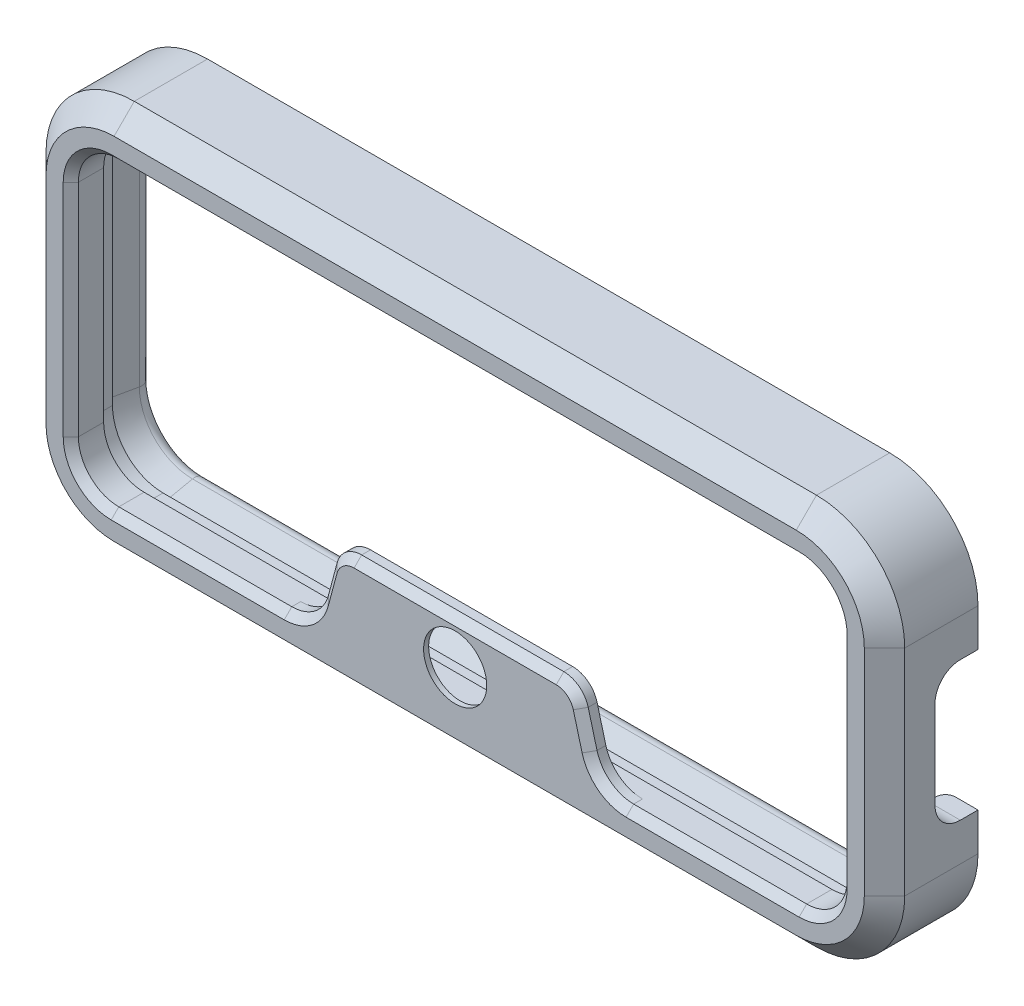
from build123d import *
from build123d.topology import SkipClean

# Parameters (mm, degrees)
SKIZZE1_W                         = 7.626009652
SKIZZE1_H                         = 10.039014478
AUFSATZ_LINEAR_AUSTRAGEN1_DEPTH   = 1.5
AUFSATZ_LINEAR_AUSTRAGEN1_2_DEPTH = 1.5
AUFSATZ_LINEAR_AUSTRAGEN1_3_DEPTH = 1.5
AUFSATZ_LINEAR_AUSTRAGEN1_4_DEPTH = 1.5
AUFSATZ_LINEAR_AUSTRAGEN1_5_DEPTH = 1.5
SKIZZE2_R                         = 2.5
AUFSATZ_LINEAR_AUSTRAGEN2_DEPTH   = 0.4
AUFSATZ_LINEAR_AUSTRAGEN3_DEPTH   = 2.2
AUFSATZ_LINEAR_AUSTRAGEN14_DEPTH  = 7
SKIZZE14_R                        = 2.5
SKIZZE14_W                        = 7.626009652
SKIZZE14_H                        = 10.039014478
AUFSATZ_LINEAR_AUSTRAGEN15_DEPTH  = 0.9
VERRUNDUNG1_R                     = 0.8
SCHNITT_LINEAR_AUSTRAGEN1_DEPTH   = 5
SCHNITT_LINEAR_AUSTRAGEN2_DEPTH   = 0.9
FASE1_SIZE                        = 1.6
SCHNITT_LINEAR_AUSTRAGEN4_DEPTH   = 39.075689459
FASE2_SIZE                        = 0.6


with BuildPart() as part:
    # Skizze1 → Aufsatz-Linear austragen1 (new body)
    with BuildSketch(Plane.XY.offset(2.3000508)):
        with Locations((-8.282016764, -0.163000133)):
            Rectangle(SKIZZE1_W, SKIZZE1_H)
        Polygon((-11.69502159, 4.456507106), (-5.069011938, 4.456507106), (-5.069011938, -4.582507372), (-9.09502159, -4.582507372), (-11.69502159, -4.124057223), (-11.69502159, 0.203832093), (-9.09502159, 0.900499994), (-7.35501651, 0.900499994), (-7.35501651, -0.899500006), (-9.89502159, -0.899500006), (-9.89502159, -2.782507372), (-6.869011938, -2.782507372), (-6.869011938, 2.656507106), (-11.69502159, 2.656507106), align=None, mode=Mode.SUBTRACT)
    extrude(amount=AUFSATZ_LINEAR_AUSTRAGEN1_DEPTH)



with BuildPart() as body_2:
    # Skizze1 → Aufsatz-Linear austragen1 2 (new body)
    with BuildSketch(Plane.XY.offset(2.3000508)):
        Polygon((-15.915075673, 4.956507106), (-28.451054102, 4.956507106), (-28.451054102, -5.082507372), (-25.651054102, -5.082507372), (-25.651054102, 2.156507106), (-22.99004318, 2.156507106), (-22.99004318, -5.082507372), (-20.19004318, -5.082507372), (-20.19004318, 2.156507106), (-17.91003302, 2.156507106), (-17.91003302, -5.082507372), (-15.11003302, -5.082507372), (-15.11003302, 2.744670596), align=None)
        Polygon((-27.951054102, -4.582507372), (-26.151054102, -4.582507372), (-26.151054102, 2.656507106), (-22.49004318, 2.656507106), (-22.49004318, -4.582507372), (-20.69004318, -4.582507372), (-20.69004318, 2.656507106), (-17.41003302, 2.656507106), (-17.41003302, -4.582507372), (-15.61003302, -4.582507372), (-15.61003302, 2.656507106), (-16.265179442, 4.456507106), (-27.951054102, 4.456507106), align=None, mode=Mode.SUBTRACT)
    extrude(amount=AUFSATZ_LINEAR_AUSTRAGEN1_2_DEPTH)


with BuildPart() as body_3:
    # Skizze1 → Aufsatz-Linear austragen1 3 (new body)
    with BuildSketch(Plane.XY.offset(2.3000508)):
        Polygon((5.972009144, 4.956507106), (3.559004318, 4.956507106), (3.559004318, 8.89351498), (0.759004318, 8.89351498), (0.759004318, 4.956507106), (-1.654000508, 4.956507106), (-1.654000508, 2.156507106), (0.759004318, 2.156507106), (0.759004318, -5.082507372), (5.972009144, -5.082507372), (5.972009144, -2.282507372), (3.559004318, -2.282507372), (3.559004318, 2.156507106), (5.972009144, 2.156507106), align=None)
        Polygon((1.259004318, 8.39351498), (1.259004318, 4.456507106), (-1.154000508, 4.456507106), (-1.154000508, 2.656507106), (1.259004318, 2.656507106), (1.259004318, -4.582507372), (5.472009144, -4.582507372), (5.472009144, -2.782507372), (3.059004318, -2.782507372), (3.059004318, 2.656507106), (5.472009144, 2.656507106), (5.472009144, 4.456507106), (3.059004318, 4.456507106), (3.059004318, 8.39351498), align=None, mode=Mode.SUBTRACT)
    extrude(amount=AUFSATZ_LINEAR_AUSTRAGEN1_3_DEPTH)


with BuildPart() as body_4:
    # Skizze1 → Aufsatz-Linear austragen1 4 (new body)
    with BuildSketch(Plane.XY.offset(2.3000508)):
        Polygon((10.972977453, 4.956507106), (16.513030226, 4.956507106), (16.513030226, 2.156507106), (12.264129895, 2.156507106), (11.687020574, 1.579397784), (11.687020574, -1.705398051), (12.264129895, -2.282507372), (16.513030226, -2.282507372), (16.513030226, -5.082507372), (10.972977453, -5.082507372), (8.887020574, -3.332181725), (8.887020574, 3.206181458), align=None)
        Polygon((16.013030226, 2.656507106), (12.057023114, 2.656507106), (11.187020574, 1.786504566), (11.187020574, -1.912504832), (12.057023114, -2.782507372), (16.013030226, -2.782507372), (16.013030226, -4.582507372), (11.15496257, -4.582507372), (9.387020574, -3.099027896), (9.387020574, 2.973027629), (11.15496257, 4.456507106), (16.013030226, 4.456507106), align=None, mode=Mode.SUBTRACT)
    extrude(amount=AUFSATZ_LINEAR_AUSTRAGEN1_4_DEPTH)


with BuildPart() as body_5:
    # Skizze1 → Aufsatz-Linear austragen1 5 (new body)
    with BuildSketch(Plane.XY.offset(2.3000508)):
        Polygon((27.321990188, 4.856507106), (22.128041656, 4.856507106), (22.128041656, 8.666514726), (19.528041656, 8.666514726), (19.528041656, -4.982507372), (22.128041656, -4.982507372), (22.128041656, 2.256507106), (25.497053594, 2.256507106), (25.497053594, -4.982507372), (28.097053594, -4.982507372), (28.097053594, 2.727037898), align=None)
        Polygon((19.928041656, 8.266514726), (19.928041656, -4.582507372), (21.728041656, -4.582507372), (21.728041656, 2.656507106), (25.897053594, 2.656507106), (25.897053594, -4.582507372), (27.697053594, -4.582507372), (27.697053594, 2.656507106), (27.041907172, 4.456507106), (21.728041656, 4.456507106), (21.728041656, 8.266514726), align=None, mode=Mode.SUBTRACT)
    extrude(amount=AUFSATZ_LINEAR_AUSTRAGEN1_5_DEPTH)


with BuildPart() as part_1:
    add(part.part)

    add(body_2.part)  # Aufsatz-Linear austragen2 merges body 2

    add(body_3.part)  # Aufsatz-Linear austragen2 merges body 3

    add(body_4.part)  # Aufsatz-Linear austragen2 merges body 4

    add(body_5.part)  # Aufsatz-Linear austragen2 merges body 5
    # Skizze2 → Aufsatz-Linear austragen2 (add)
    with BuildSketch(Plane.XY.offset(3.8000508)):
        with BuildLine():
            Line((-27.00005334, 15.487325375), (27.00005588, 15.487325375))
            ThreePointArc((27.00005588, 15.487325375), (31.940828463, 13.440790362), (33.987363475, 8.50001778))
            Line((33.987363475, 8.50001778), (33.987363475, -8.50001778))
            ThreePointArc((33.987363475, -8.50001778), (31.940828463, -13.440790362), (27.00005588, -15.487325375))
            Line((27.00005588, -15.487325375), (-27.00005334, -15.487325375))
            ThreePointArc((-27.00005334, -15.487325375), (-31.940825922, -13.440790362), (-33.987360935, -8.50001778))
            Line((-33.987360935, -8.50001778), (-33.987360935, 8.50001778))
            ThreePointArc((-33.987360935, 8.50001778), (-31.940825922, 13.440790362), (-27.00005334, 15.487325375))
        make_face()
        with Locations((0, -9.017018034)):
            Circle(SKIZZE2_R, mode=Mode.SUBTRACT)
    extrude(amount=AUFSATZ_LINEAR_AUSTRAGEN2_DEPTH)

    # Skizze3 → Aufsatz-Linear austragen3 (add)
    with BuildSketch(Plane(origin=(0, 0, 3.8000508), x_dir=(-1, 0, 0), z_dir=(0, 0, -1))):
        with BuildLine():
            Line((-27.225, -12.725), (27.225, -12.725))
            ThreePointArc((27.225, -12.725), (30.053427125, -11.553427125), (31.225, -8.725))
            Line((31.225, -8.725), (31.225, 8.725))
            ThreePointArc((31.225, 8.725), (30.053427125, 11.553427125), (27.225, 12.725))
            Line((27.225, 12.725), (-27.225, 12.725))
            ThreePointArc((-27.225, 12.725), (-30.053427125, 11.553427125), (-31.225, 8.725))
            Line((-31.225, 8.725), (-31.225, -8.725))
            ThreePointArc((-31.225, -8.725), (-30.053427125, -11.553427125), (-27.225, -12.725))
        make_face()
        with BuildLine():
            Line((-27.225, 11.925), (27.225, 11.925))
            ThreePointArc((27.225, 11.925), (29.4877417, 10.9877417), (30.425, 8.725))
            Line((30.425, 8.725), (30.425, -8.725))
            ThreePointArc((30.425, -8.725), (29.4877417, -10.9877417), (27.225, -11.925))
            Line((27.225, -11.925), (-27.225, -11.925))
            ThreePointArc((-27.225, -11.925), (-29.4877417, -10.9877417), (-30.425, -8.725))
            Line((-30.425, -8.725), (-30.425, 8.725))
            ThreePointArc((-30.425, 8.725), (-29.4877417, 10.9877417), (-27.225, 11.925))
        make_face(mode=Mode.SUBTRACT)
    extrude(amount=AUFSATZ_LINEAR_AUSTRAGEN3_DEPTH)

    # Skizze10 → Aufsatz-Linear austragen14 (add)
    with BuildSketch(Plane(origin=(0, 0, 3.8000508), x_dir=(-1, 0, 0), z_dir=(0, 0, -1))):
        with BuildLine():
            Line((27.00005334, 15.487325375), (-27.00005588, 15.487325375))
            ThreePointArc((-27.00005588, 15.487325375), (-31.940828463, 13.440790362), (-33.987363475, 8.50001778))
            Line((-33.987363475, 8.50001778), (-33.987363475, -8.50001778))
            ThreePointArc((-33.987363475, -8.50001778), (-31.940828463, -13.440790362), (-27.00005588, -15.487325375))
            Line((-27.00005588, -15.487325375), (27.00005334, -15.487325375))
            ThreePointArc((27.00005334, -15.487325375), (31.940825922, -13.440790362), (33.987360935, -8.50001778))
            Line((33.987360935, -8.50001778), (33.987360935, 8.50001778))
            ThreePointArc((33.987360935, 8.50001778), (31.940825922, 13.440790362), (27.00005334, 15.487325375))
        make_face()
        with BuildLine():
            Line((31.225, -8.725), (31.225, 8.725))
            ThreePointArc((31.225, 8.725), (30.053427125, 11.553427125), (27.225, 12.725))
            Line((27.225, 12.725), (-27.225, 12.725))
            ThreePointArc((-27.225, 12.725), (-30.053427125, 11.553427125), (-31.225, 8.725))
            Line((-31.225, 8.725), (-31.225, -8.725))
            ThreePointArc((-31.225, -8.725), (-30.053427125, -11.553427125), (-27.225, -12.725))
            Line((-27.225, -12.725), (27.225, -12.725))
            ThreePointArc((27.225, -12.725), (30.053427125, -11.553427125), (31.225, -8.725))
        make_face(mode=Mode.SUBTRACT)
    extrude(amount=AUFSATZ_LINEAR_AUSTRAGEN14_DEPTH)

    # Skizze14 → Aufsatz-Linear austragen15 (add)
    with BuildSketch(Plane(origin=(0, 0, 3.8000508), x_dir=(-1, 0, 0), z_dir=(0, 0, -1))):
        with BuildLine():
            Line((27.225, 11.925), (-27.225, 11.925))
            ThreePointArc((-27.225, 11.925), (-29.4877417, 10.9877417), (-30.425, 8.725))
            Line((-30.425, 8.725), (-30.425, -8.725))
            ThreePointArc((-30.425, -8.725), (-29.4877417, -10.9877417), (-27.225, -11.925))
            Line((-27.225, -11.925), (27.225, -11.925))
            ThreePointArc((27.225, -11.925), (29.4877417, -10.9877417), (30.425, -8.725))
            Line((30.425, -8.725), (30.425, 8.725))
            ThreePointArc((30.425, 8.725), (29.4877417, 10.9877417), (27.225, 11.925))
        make_face()
        with Locations((0, -9.017018034)):
            Circle(SKIZZE14_R, mode=Mode.SUBTRACT)
        with Locations((8.282016764, -0.163000133)):
            Rectangle(SKIZZE14_W, SKIZZE14_H, mode=Mode.SUBTRACT)
        Polygon((15.915075673, 4.956507106), (15.11003302, 2.744670596), (15.11003302, -5.082507372), (17.91003302, -5.082507372), (17.91003302, 2.156507106), (20.19004318, 2.156507106), (20.19004318, -5.082507372), (22.99004318, -5.082507372), (22.99004318, 2.156507106), (25.651054102, 2.156507106), (25.651054102, -5.082507372), (28.451054102, -5.082507372), (28.451054102, 4.956507106), align=None, mode=Mode.SUBTRACT)
        Polygon((-5.972009144, 4.956507106), (-5.972009144, 2.156507106), (-3.559004318, 2.156507106), (-3.559004318, -2.282507372), (-5.972009144, -2.282507372), (-5.972009144, -5.082507372), (-0.759004318, -5.082507372), (-0.759004318, 2.156507106), (1.654000508, 2.156507106), (1.654000508, 4.956507106), (-0.759004318, 4.956507106), (-0.759004318, 8.89351498), (-3.559004318, 8.89351498), (-3.559004318, 4.956507106), align=None, mode=Mode.SUBTRACT)
        Polygon((-8.887020574, 3.206181458), (-10.972977453, 4.956507106), (-16.513030226, 4.956507106), (-16.513030226, 2.156507106), (-12.264129895, 2.156507106), (-11.687020574, 1.579397784), (-11.687020574, -1.705398051), (-12.264129895, -2.282507372), (-16.513030226, -2.282507372), (-16.513030226, -5.082507372), (-10.972977453, -5.082507372), (-8.887020574, -3.332181725), align=None, mode=Mode.SUBTRACT)
        Polygon((-27.321990188, 4.856507106), (-28.097053594, 2.727037898), (-28.097053594, -4.982507372), (-25.497053594, -4.982507372), (-25.497053594, 2.256507106), (-22.128041656, 2.256507106), (-22.128041656, -4.982507372), (-19.528041656, -4.982507372), (-19.528041656, 8.666514726), (-22.128041656, 8.666514726), (-22.128041656, 4.856507106), align=None, mode=Mode.SUBTRACT)
    extrude(amount=AUFSATZ_LINEAR_AUSTRAGEN15_DEPTH)

    # Schnitt-Austragung1: sweep along a path in Skizze12
    with BuildLine(Plane(origin=(0, 0, -3.1999492), x_dir=(-1, 0, 0), z_dir=(0, 0, -1))) as schnitt_austragung1_path:
        Line((31.225, -8.725), (31.225, 8.725))
        ThreePointArc((31.225, 8.725), (30.053427125, 11.553427125), (27.225, 12.725))
        Line((27.225, 12.725), (-27.225, 12.725))
        ThreePointArc((-27.225, 12.725), (-30.053427125, 11.553427125), (-31.225, 8.725))
        Line((-31.225, 8.725), (-31.225, -8.725))
        ThreePointArc((-31.225, -8.725), (-30.053427125, -11.553427125), (-27.225, -12.725))
        Line((-27.225, -12.725), (27.225, -12.725))
        ThreePointArc((27.225, -12.725), (30.053427125, -11.553427125), (31.225, -8.725))
    # Skizze11 → Schnitt-Austragung1 (sweep, cut)
    with BuildSketch(Plane(origin=(0, 0, 0), x_dir=(0, 0, -1), z_dir=(1, 0, 0))):
        Polygon((3.1999492, 12.725), (-0.1000508, 12.725), (-0.1000508, 13.426436654), align=None)
    sweep(path=schnitt_austragung1_path.line, mode=Mode.SUBTRACT)

    # Verrundung1
    verrundung1_edges = [part_1.edges().sort_by_distance(p)[0] for p in [
        (-30.053427125, -11.553427125, -3.1999492),
        (0, -12.725, -3.1999492),
        (30.053427125, -11.553427125, -3.1999492),
        (31.225, 0, -3.1999492),
        (30.053427125, 11.553427125, -3.1999492),
        (0, 12.725, -3.1999492),
        (0, 12.725, -3.1999492),
        (-30.053427125, 11.553427125, -3.1999492),
        (-31.225, 0, -3.1999492),
    ]]
    fillet(verrundung1_edges, radius=VERRUNDUNG1_R)

    # Skizze13 → Schnitt-Linear austragen1 (cut)
    with BuildSketch(Plane(origin=(33.987363475, 0, 0), x_dir=(0, 0, -1), z_dir=(1, 0, 0))):
        with BuildLine():
            Line((1.7999492, -5.5), (3.9999492, -5.5))
            ThreePointArc((3.9999492, -5.5), (5.414162762, -4.914213562), (5.9999492, -3.5))
            Line((5.9999492, -3.5), (5.9999492, 3.5))
            ThreePointArc((5.9999492, 3.5), (5.414162762, 4.914213562), (3.9999492, 5.5))
            Line((3.9999492, 5.5), (1.7999492, 5.5))
            ThreePointArc((1.7999492, 5.5), (0.385735638, 4.914213562), (-0.2000508, 3.5))
            Line((-0.2000508, 3.5), (-0.2000508, -3.5))
            ThreePointArc((-0.2000508, -3.5), (0.385735638, -4.914213562), (1.7999492, -5.5))
        make_face()
    extrude(amount=-SCHNITT_LINEAR_AUSTRAGEN1_DEPTH, mode=Mode.SUBTRACT)

    # Skizze15 → Schnitt-Linear austragen2 (cut)
    with SkipClean():  # the faces are left unmerged after this step: merging them gives an invalid solid
        with BuildSketch(Plane(origin=(0, 0, 2.9000508), x_dir=(-1, 0, 0), z_dir=(0, 0, -1))):
            with BuildLine():
                Line((-5, -6.109036068), (5, -6.109036068))
                ThreePointArc((5, -6.109036068), (7.907981966, -9.017018034), (5, -11.925))
                Line((5, -11.925), (-5, -11.925))
                ThreePointArc((-5, -11.925), (-7.907981966, -9.017018034), (-5, -6.109036068))
            make_face()
        extrude(amount=-SCHNITT_LINEAR_AUSTRAGEN2_DEPTH, mode=Mode.SUBTRACT)

    # Fase1
    fase1_edges = [part_1.edges().sort_by_distance(p)[0] for p in [
        (-31.940825922, -13.440790362, 4.2000508),
        (1.27e-06, -15.487325375, 4.2000508),
        (-33.987360935, 0, 4.2000508),
        (31.940828463, -13.440790362, 4.2000508),
        (-31.940825922, 13.440790362, 4.2000508),
        (33.987363475, 0, 4.2000508),
        (1.27e-06, 15.487325375, 4.2000508),
        (31.940828463, 13.440790362, 4.2000508),
    ]]
    chamfer(fase1_edges, length=FASE1_SIZE)

    # Skizze18 → Schnitt-Linear austragen4 (cut, through all)
    with SkipClean():  # the faces are left unmerged after this step: merging them gives an invalid solid
        with BuildSketch(Plane.XY.offset(4.2000508)):
            with BuildLine():
                Line((-27.225, 11.925), (27.225, 11.925))
                ThreePointArc((27.225, 11.925), (29.4877417, 10.9877417), (30.425, 8.725))
                Line((30.425, 8.725), (30.425, -8.725))
                ThreePointArc((30.425, -8.725), (29.4877417, -10.9877417), (27.225, -11.925))
                Line((27.225, -11.925), (13.528992375, -11.925))
                ThreePointArc((13.528992375, -11.925), (11.702708088, -11.305060021), (10.631214896, -9.701457135))
                Line((10.631214896, -9.701457135), (9.931851653, -7.091397978))
                ThreePointArc((9.931851653, -7.091397978), (9.217522858, -6.022329387), (8, -5.609036068))
                Line((8, -5.609036068), (-8, -5.609036068))
                ThreePointArc((-8, -5.609036068), (-9.217522858, -6.022329387), (-9.931851653, -7.091397978))
                Line((-9.931851653, -7.091397978), (-10.631214896, -9.701457135))
                ThreePointArc((-10.631214896, -9.701457135), (-11.702708088, -11.305060021), (-13.528992375, -11.925))
                Line((-13.528992375, -11.925), (-27.225, -11.925))
                ThreePointArc((-27.225, -11.925), (-29.4877417, -10.9877417), (-30.425, -8.725))
                Line((-30.425, -8.725), (-30.425, 8.725))
                ThreePointArc((-30.425, 8.725), (-29.4877417, 10.9877417), (-27.225, 11.925))
            make_face()
        extrude(amount=-SCHNITT_LINEAR_AUSTRAGEN4_DEPTH, mode=Mode.SUBTRACT)
    add(part_1.part.scale(1), mode=Mode.REPLACE)  # the faces are merged on a copy

    # Fase2
    fase2_edges = [part_1.edges().sort_by_distance(p)[0] for p in [
        (0, -5.609036068, 4.2000508),
        (9.217522858, -6.022329387, 4.2000508),
        (-9.217522858, -6.022329387, 4.2000508),
        (10.281533274, -8.396427557, 4.2000508),
        (-10.281533274, -8.396427557, 4.2000508),
        (11.702708088, -11.305060021, 4.2000508),
        (-11.702708088, -11.305060021, 4.2000508),
        (20.376996187, -11.925, 4.2000508),
        (-20.376996187, -11.925, 4.2000508),
        (29.4877417, -10.9877417, 4.2000508),
        (-29.4877417, -10.9877417, 4.2000508),
        (30.425, 0, 4.2000508),
        (-30.425, 0, 4.2000508),
        (29.4877417, 10.9877417, 4.2000508),
        (-29.4877417, 10.9877417, 4.2000508),
        (0, 11.925, 4.2000508),
    ]]
    chamfer(fase2_edges, length=FASE2_SIZE)


solid = part_1.part
